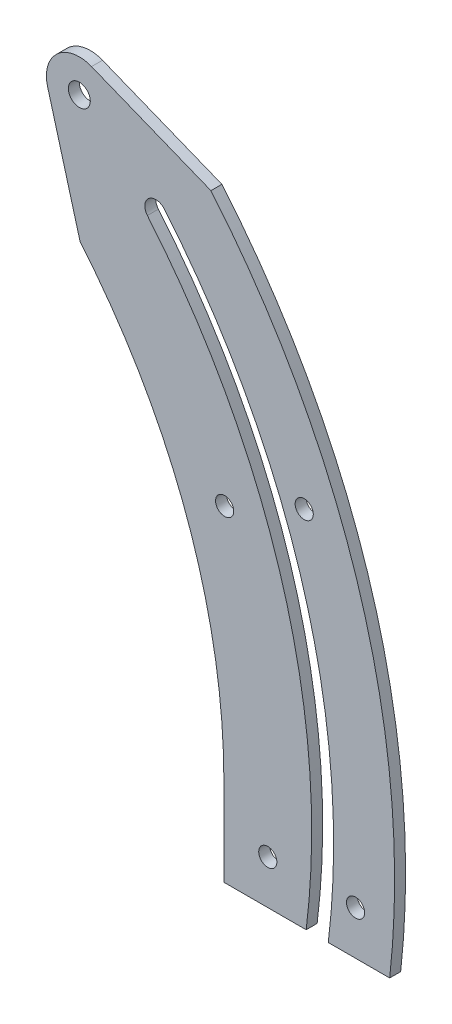
from build123d import *

# Parameters (mm, degrees)
COPIED_SKETCH_DONT_MESS_WITH_DEPTH = 3.175
SKETCH3_R                          = 3.175
HOLE_FOR_TOP_SUPPORT_BRACING_DEPTH = 279.209368662
SKETCH4_R                          = 3.175
MAKING_IT_MACHINABLE_DEPTH         = 279.209368662
CUT_EXTRUDE1_DEPTH                 = 279.209368662
CUT_EXTRUDE1_DEPTH_BACK            = 279.209368662
SKETCH5_R                          = 2.6289


with BuildPart() as part:
    # Sketch2 → Copied sketch - dont mess with (new body)
    with BuildSketch(Plane.XY):
        with BuildLine():
            Line((155.660230842, 130.614442288), (160.524613056, 134.69614361))
            ThreePointArc((160.524613056, 134.69614361), (200.900960932, 59.581930119), (208.004909798, -25.4))
            Line((208.004909798, -25.4), (225.775729431, -25.4))
            ThreePointArc((225.775729431, -25.4), (217.513785946, 65.632255207), (174.045297477, 146.041344921))
            Line((174.045297477, 146.041344921), (139.503343029, 159.851365822))
            ThreePointArc((139.503343029, 159.851365822), (129.618020291, 158.107153482), (126.784391338, 148.47738561))
            Line((126.784391338, 148.47738561), (136.202701987, 114.287637002))
            ThreePointArc((136.202701987, 114.287637002), (167.077347976, 60.811181483), (177.8, 0))
            Line((177.8, 0), (177.8, -25.4))
            Line((177.8, -25.4), (201.606249903, -25.4))
            ThreePointArc((201.606249903, -25.4), (194.922962004, 57.404519712), (155.660230842, 130.614442288))
        make_face()
    extrude(amount=COPIED_SKETCH_DONT_MESS_WITH_DEPTH)

    # Sketch3 → Hole for top support bracing (cut, through all)
    with BuildSketch(Plane.XY.offset(3.175)):
        with Locations((135.967339212, 151.007028537)):
            Circle(SKETCH3_R)
    extrude(amount=-HOLE_FOR_TOP_SUPPORT_BRACING_DEPTH, mode=Mode.SUBTRACT)

    # Sketch4 → Making it machinable (cut, through all)
    with BuildSketch(Plane.XY.offset(3.175)):
        with Locations((158.092421949, 132.655292949)):
            Circle(SKETCH4_R)
    extrude(amount=-MAKING_IT_MACHINABLE_DEPTH, mode=Mode.SUBTRACT)

    # Sketch5 → Cut-Extrude1 (cut, two sides: drawn at the far end of the back side and taken through both)
    with BuildSketch(Plane.XY.offset(3.175).offset(-CUT_EXTRUDE1_DEPTH_BACK)):
        with Locations((190.5, -12.7)):
            Circle(SKETCH5_R)
        with Locations((215.9, -12.7)):
            Circle(SKETCH5_R)
        with Locations((178.018885355, 68.998669966)):
            Circle(SKETCH5_R)
        with Locations((201.039103145, 79.733173814)):
            Circle(SKETCH5_R)
    extrude(amount=CUT_EXTRUDE1_DEPTH + CUT_EXTRUDE1_DEPTH_BACK, mode=Mode.SUBTRACT)


solid = part.part
